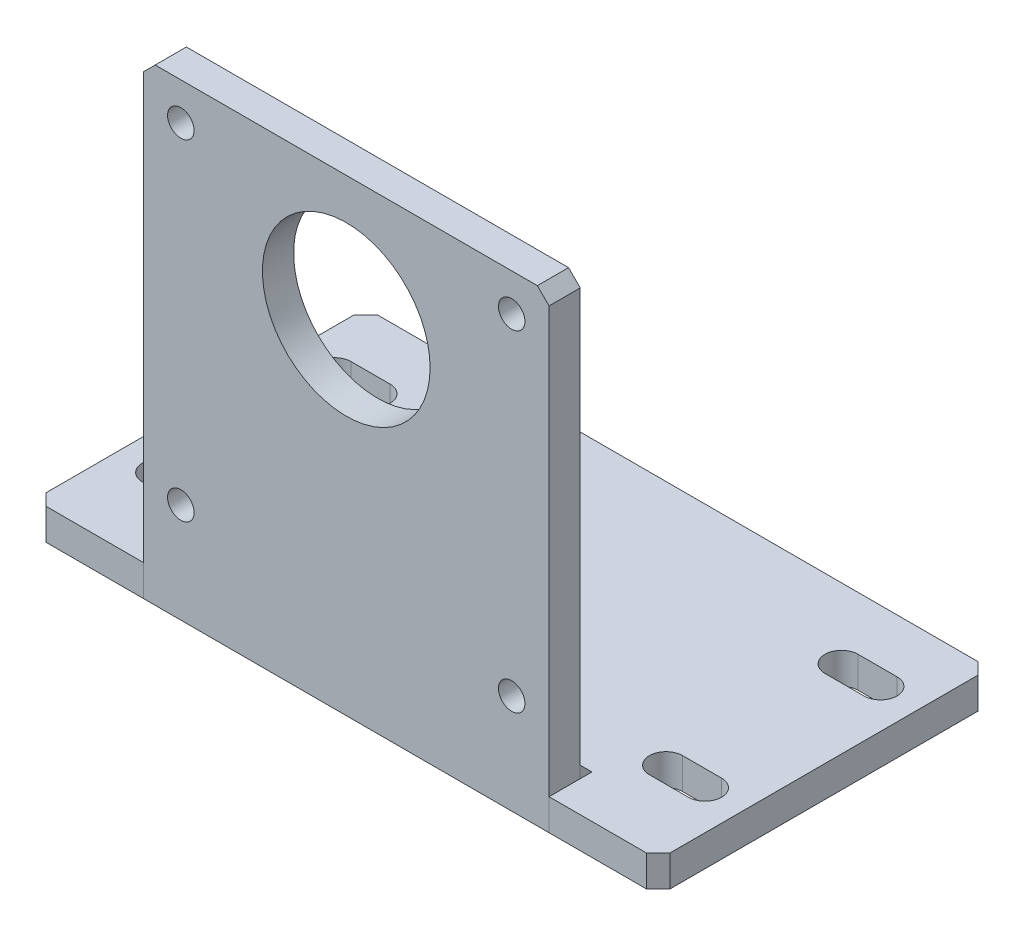
from build123d import *

# Parameters (mm, degrees)
SKETCH1_W                  = 104
SKETCH1_H                  = 120
SKETCH1_R                  = 21.5
BOSS_EXTRUDE1_DEPTH        = 8
BOSS_EXTRUDE2_DEPTH        = 8
FILLET_START               = -52
FILLET_BEAD1_DEPTH         = 104
M8_TAPPED_HOLE1_AT_2_COUNT = 2
M8_TAPPED_HOLE1_AT_2_PITCH = 84.852813742
M8_TAPPED_HOLE1_AT_3_COUNT = 2
M8_TAPPED_HOLE1_AT_3_PITCH = 120
M8_TAPPED_HOLE1_AT_4_COUNT = 2
M8_TAPPED_HOLE1_AT_4_PITCH = 84.852813742
CHAMFER1_SIZE              = 3
CHAMFER2_SIZE              = 3
CUT_EXTRUDE1_DEPTH         = 8


# Read off the part's stored shape, not the designer's step: Fillet Bead1
with BuildPart() as part:
    # Sketch1 → Boss-Extrude1 (new body)
    with BuildSketch(Plane.XY):
        Rectangle(SKETCH1_W, SKETCH1_H)
        with Locations((0, 28)):
            Circle(SKETCH1_R, mode=Mode.SUBTRACT)
    extrude(amount=BOSS_EXTRUDE1_DEPTH)

    # Sketch4 → M8 Tapped Hole1 (revolve, cut)
    with BuildSketch(Plane(origin=(-42.426406871, -34.426406871, 8), x_dir=(0, -1, 0), z_dir=(1, 0, 0))):
        Polygon((0, 0), (0, 21.792926105), (3.4, 19.75), (3.4, 0), align=None)
    m8_tapped_hole1 = revolve(axis=Axis((-42.426406871, -34.426406871, 14.35), (0, 0, -1)), mode=Mode.SUBTRACT)

    # M8 Tapped Hole1 at 2: M8 Tapped Hole1 ×2
    with Locations(*[(i * M8_TAPPED_HOLE1_AT_2_PITCH, 0, 0) for i in range(1, M8_TAPPED_HOLE1_AT_2_COUNT)]):
        add(m8_tapped_hole1, mode=Mode.SUBTRACT)

    # M8 Tapped Hole1 at 3: M8 Tapped Hole1 ×2
    with Locations(*[Vector(0.7071067811865486, 0.7071067811865465, 0) * (i * M8_TAPPED_HOLE1_AT_3_PITCH) for i in range(1, M8_TAPPED_HOLE1_AT_3_COUNT)]):
        add(m8_tapped_hole1, mode=Mode.SUBTRACT)

    # M8 Tapped Hole1 at 4: M8 Tapped Hole1 ×2
    with Locations(*[(0, i * M8_TAPPED_HOLE1_AT_4_PITCH, 0) for i in range(1, M8_TAPPED_HOLE1_AT_4_COUNT)]):
        add(m8_tapped_hole1, mode=Mode.SUBTRACT)

    # Chamfer1
    chamfer1_edges = [part.edges().sort_by_distance(p)[0] for p in [
        (-52, 60, 4),
        (52, 60, 4),
    ]]
    chamfer(chamfer1_edges, length=CHAMFER1_SIZE)


with BuildPart() as body_2:
    # Sketch2 → Boss-Extrude2 (new body)
    with BuildSketch(Plane.XZ.offset(60)):
        Polygon((-52, 0), (-52, 8), (-80, 8), (-80, -77), (80, -77), (80, 8), (52, 8), (52, 0), align=None)
    extrude(amount=-BOSS_EXTRUDE2_DEPTH)

    # Chamfer2
    chamfer2_edges = [body_2.edges().sort_by_distance(p)[0] for p in [
        (-80, -56, 8),
        (80, -56, 8),
        (80, -56, -77),
        (-80, -56, -77),
    ]]
    chamfer(chamfer2_edges, length=CHAMFER2_SIZE)

    # Sketch5 → Cut-Extrude1 (cut)
    with BuildSketch(Plane(origin=(0, -52, 0), x_dir=(1, 0, 0), z_dir=(0, 1, 0))):
        with BuildLine():
            Line((-70, 54.75), (-60, 54.75))
            ThreePointArc((-60, 54.75), (-55.75, 59), (-60, 63.25))
            Line((-60, 63.25), (-70, 63.25))
            ThreePointArc((-70, 63.25), (-74.25, 59), (-70, 54.75))
        make_face()
        with BuildLine():
            Line((-70, 9.75), (-60, 9.75))
            ThreePointArc((-60, 9.75), (-55.75, 14), (-60, 18.25))
            Line((-60, 18.25), (-70, 18.25))
            ThreePointArc((-70, 18.25), (-74.25, 14), (-70, 9.75))
        make_face()
        with BuildLine():
            Line((70, 18.25), (60, 18.25))
            ThreePointArc((60, 18.25), (55.75, 14), (60, 9.75))
            Line((60, 9.75), (70, 9.75))
            ThreePointArc((70, 9.75), (74.25, 14), (70, 18.25))
        make_face()
        with BuildLine():
            Line((70, 63.25), (60, 63.25))
            ThreePointArc((60, 63.25), (55.75, 59), (60, 54.75))
            Line((60, 54.75), (70, 54.75))
            ThreePointArc((70, 54.75), (74.25, 59), (70, 63.25))
        make_face()
    extrude(amount=-CUT_EXTRUDE1_DEPTH, mode=Mode.SUBTRACT)


with BuildPart() as body_3:
    # Fillet Bead1 outline → Fillet Bead1 (new body)
    with BuildSketch(Plane.YZ.offset(FILLET_START)):
        Polygon((-52, -3), (-49, 0), (-52, 0), align=None)
    extrude(amount=FILLET_BEAD1_DEPTH)


solid = Compound([part.part, body_2.part, body_3.part])
